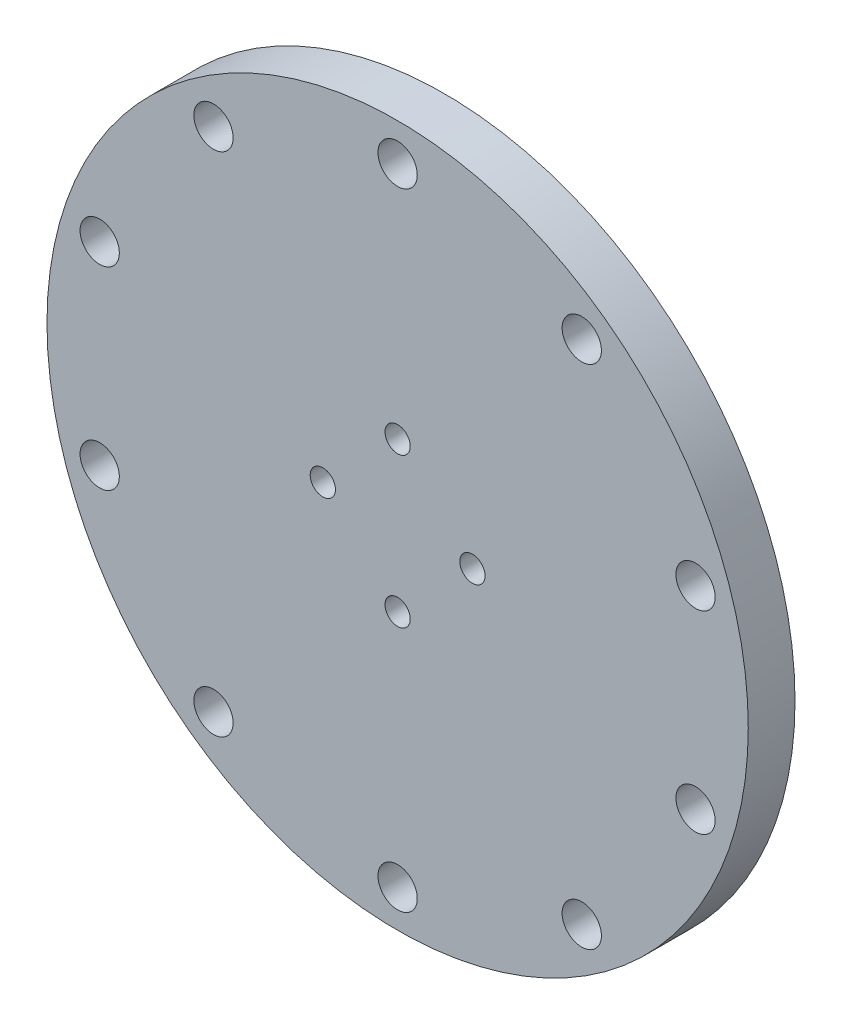
from build123d import *

# Parameters (mm, degrees)
SKETCH1_R           = 37.5
SKETCH1_R_2         = 1.35
SKETCH1_R_3         = 2.1
BOSS_EXTRUDE1_DEPTH = 3
BOSS_EXTRUDE2_START = 2
SKETCH2_R           = 37.5
SKETCH2_R_2         = 29.5
SKETCH2_R_3         = 2.1
BOSS_EXTRUDE2_DEPTH = 2
BOSS_EXTRUDE3_START = 2
SKETCH3_R           = 11.35
SKETCH3_R_2         = 1.35
BOSS_EXTRUDE3_DEPTH = 2
FILLET2_R           = 10
FILLET3_R           = 10


with BuildPart() as part:
    # Sketch1 → Boss-Extrude1 (new body)
    with BuildSketch(Plane.XY):
        Circle(SKETCH1_R)
        with Locations((0, 8)):
            Circle(SKETCH1_R_2, mode=Mode.SUBTRACT)
        with Locations((0, -8)):
            Circle(SKETCH1_R_2, mode=Mode.SUBTRACT)
        with Locations((8, 0)):
            Circle(SKETCH1_R_2, mode=Mode.SUBTRACT)
        with Locations((-8, 0)):
            Circle(SKETCH1_R_2, mode=Mode.SUBTRACT)
        with Locations((0, 33.5)):
            Circle(SKETCH1_R_3, mode=Mode.SUBTRACT)
        with Locations((19.690805952, 27.102069312)):
            Circle(SKETCH1_R_3, mode=Mode.SUBTRACT)
        with Locations((31.860393296, 10.352069312)):
            Circle(SKETCH1_R_3, mode=Mode.SUBTRACT)
        with Locations((31.860393296, -10.352069312)):
            Circle(SKETCH1_R_3, mode=Mode.SUBTRACT)
        with Locations((19.690805952, -27.102069312)):
            Circle(SKETCH1_R_3, mode=Mode.SUBTRACT)
        with Locations((0, -33.5)):
            Circle(SKETCH1_R_3, mode=Mode.SUBTRACT)
        with Locations((-19.690805952, -27.102069312)):
            Circle(SKETCH1_R_3, mode=Mode.SUBTRACT)
        with Locations((-31.860393296, -10.352069312)):
            Circle(SKETCH1_R_3, mode=Mode.SUBTRACT)
        with Locations((-31.860393296, 10.352069312)):
            Circle(SKETCH1_R_3, mode=Mode.SUBTRACT)
        with Locations((-19.690805952, 27.102069312)):
            Circle(SKETCH1_R_3, mode=Mode.SUBTRACT)
    extrude(amount=BOSS_EXTRUDE1_DEPTH)

    # Sketch2 → Boss-Extrude2 (add)
    with BuildSketch(Plane(origin=(0, 0, 0), x_dir=(-1, 0, 0), z_dir=(0, 0, -1)).offset(BOSS_EXTRUDE2_START)):
        Circle(SKETCH2_R)
        Circle(SKETCH2_R_2, mode=Mode.SUBTRACT)
        with Locations((-19.690805952, 27.102069312)):
            Circle(SKETCH2_R_3, mode=Mode.SUBTRACT)
        with Locations((-31.860393296, 10.352069312)):
            Circle(SKETCH2_R_3, mode=Mode.SUBTRACT)
        with Locations((-31.860393296, -10.352069312)):
            Circle(SKETCH2_R_3, mode=Mode.SUBTRACT)
        with Locations((-19.690805952, -27.102069312)):
            Circle(SKETCH2_R_3, mode=Mode.SUBTRACT)
        with Locations((0, -33.5)):
            Circle(SKETCH2_R_3, mode=Mode.SUBTRACT)
        with Locations((0, 33.5)):
            Circle(SKETCH2_R_3, mode=Mode.SUBTRACT)
        with Locations((19.690805952, -27.102069312)):
            Circle(SKETCH2_R_3, mode=Mode.SUBTRACT)
        with Locations((31.860393296, -10.352069312)):
            Circle(SKETCH2_R_3, mode=Mode.SUBTRACT)
        with Locations((31.860393296, 10.352069312)):
            Circle(SKETCH2_R_3, mode=Mode.SUBTRACT)
        with Locations((19.690805952, 27.102069312)):
            Circle(SKETCH2_R_3, mode=Mode.SUBTRACT)
    extrude(amount=-BOSS_EXTRUDE2_DEPTH)

    # Sketch3 → Boss-Extrude3 (add)
    with BuildSketch(Plane(origin=(0, 0, 0), x_dir=(-1, 0, 0), z_dir=(0, 0, -1)).offset(BOSS_EXTRUDE3_START)):
        with Locations(Location((0, 0, 0), (0, 0, 180))):
            Circle(SKETCH3_R)
        with Locations((0, -8)):
            Circle(SKETCH3_R_2, mode=Mode.SUBTRACT)
        with Locations((8, 0)):
            Circle(SKETCH3_R_2, mode=Mode.SUBTRACT)
        with Locations((0, 8)):
            Circle(SKETCH3_R_2, mode=Mode.SUBTRACT)
        with Locations((-8, 0)):
            Circle(SKETCH3_R_2, mode=Mode.SUBTRACT)
    extrude(amount=-BOSS_EXTRUDE3_DEPTH)

    # Fillet2
    # the kernel refuses this fillet: 10 mm, written as the material it adds along each edge
    with BuildSketch(Plane(origin=(0, 0, 0), x_dir=(1, 0, 0), z_dir=(0, 1, 0))) as fillet2_piece_1:
        with BuildLine():
            CenterArc((17.35, 10), FILLET2_R, 233.130102354, 36.869897646)
            Line((11.35, 2), (11.23, 1.84))
            ThreePointArc((11.23, 1.84), (11.15, 1), (11.15, 0))
            Line((11.15, 0), (11.35, -0.2))
            Line((11.35, -0.2), (17.35, -0.2))
            Line((17.35, -0.2), (17.35, 0))
        make_face()
    revolve(axis=Axis((0, 0, 0), (0, 0, -1)))

    # Fillet3
    # the kernel refuses this fillet: 10 mm, written as the material it adds along each edge
    with BuildSketch(Plane(origin=(0, 0, 0), x_dir=(-1, 0, 0), z_dir=(0, -1, 0))) as fillet3_piece_1:
        with BuildLine():
            CenterArc((23.5, 10), FILLET3_R, 270, 36.869897646)
            Line((29.5, 2), (29.62, 1.84))
            ThreePointArc((29.62, 1.84), (29.7, 1), (29.7, 0))
            Line((29.7, 0), (29.5, -0.2))
            Line((29.5, -0.2), (23.5, -0.2))
            Line((23.5, -0.2), (23.5, 0))
        make_face()
    revolve(axis=Axis((0, 0, 0), (0, 0, -1)))


solid = part.part
